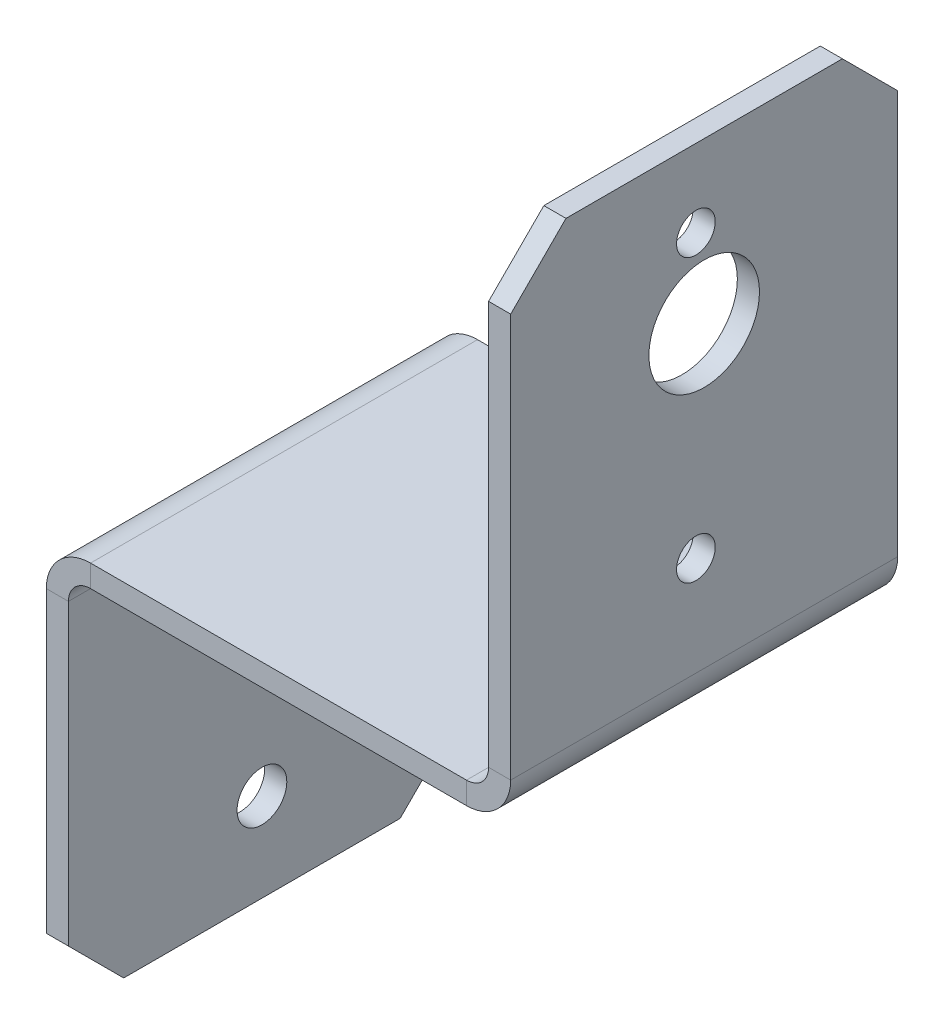
from build123d import *

# Parameters (mm, degrees)
BASE_FLANGE1_DEPTH = 35
SKETCH3_R          = 5
SKETCH3_R_2        = 1.75
CUT_EXTRUDE1_DEPTH = 10
CHAMFER1_SIZE      = 5
SKETCH4_R          = 2.25
CUT_EXTRUDE2_DEPTH = 10


# Sheet-metal steps are written as plain solids
with BuildPart() as part:
    # Sketch1 → Base-Flange1 (new body)
    with BuildSketch(Plane.XY):
        with BuildLine():
            Line((-40, -34), (-40, -2))
            ThreePointArc((-40, -2), (-39.414213562, -0.585786438), (-38, 0))
            Line((-38, 0), (-4, 0))
            ThreePointArc((-4, 0), (-1.171572875, 1.171572875), (0, 4))
            Line((0, 4), (0, 45.5))
            Line((0, 45.5), (-2, 45.5))
            Line((-2, 45.5), (-2, 4))
            ThreePointArc((-2, 4), (-2.585786438, 2.585786438), (-4, 2))
            Line((-4, 2), (-38, 2))
            ThreePointArc((-38, 2), (-40.828427125, 0.828427125), (-42, -2))
            Line((-42, -2), (-42, -34))
            Line((-42, -34), (-40, -34))
        make_face()
    extrude(amount=BASE_FLANGE1_DEPTH)

    # Sketch3 → Cut-Extrude1 (cut)
    with BuildSketch(Plane(origin=(0, 0, 0), x_dir=(0, 0, -1), z_dir=(1, 0, 0))):
        with Locations((-17.5, 31)):
            Circle(SKETCH3_R)
        with Locations((-18.25, 13)):
            Circle(SKETCH3_R_2)
        with Locations((-18.25, 38.5)):
            Circle(SKETCH3_R_2)
    extrude(amount=-CUT_EXTRUDE1_DEPTH, mode=Mode.SUBTRACT)

    # Chamfer1
    chamfer1_edges = [part.edges().sort_by_distance(p)[0] for p in [
        (-1, 45.5, 0),
        (-41, -34, 0),
        (-1, 45.5, 35),
        (-41, -34, 35),
    ]]
    chamfer(chamfer1_edges, length=CHAMFER1_SIZE)

    # Sketch4 → Cut-Extrude2 (cut)
    with BuildSketch(Plane(origin=(-40, 0, 0), x_dir=(0, 0, -1), z_dir=(1, 0, 0))):
        with Locations(Location((-17.5, -26, 0), (0, 0, 90))):
            Circle(SKETCH4_R)
        with Locations(Location((-17.5, -10, 0), (0, 0, 90))):
            Circle(SKETCH4_R)
    extrude(amount=-CUT_EXTRUDE2_DEPTH, mode=Mode.SUBTRACT)


solid = part.part
